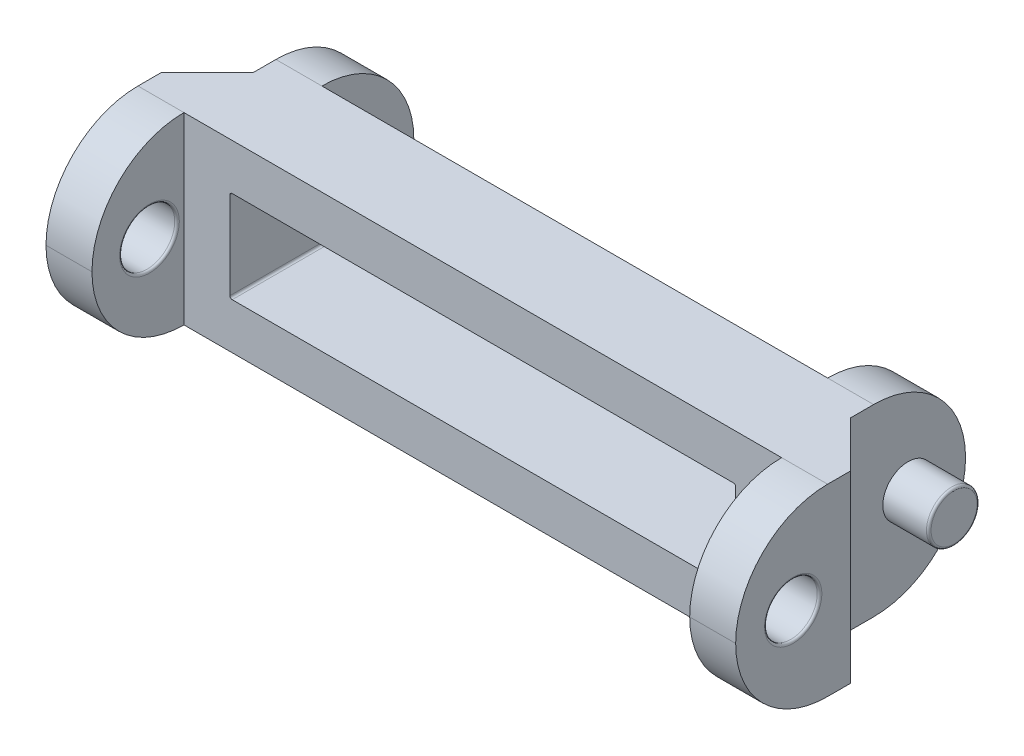
from build123d import *

# Parameters (mm, degrees)
SKETCH1_W           = 13
SKETCH1_H           = 4
SKETCH1_W_2         = 11
SKETCH1_H_2         = 2
EXTRUDE_THIN2_DEPTH = 1
SKETCH3_W           = 2.5
SKETCH3_H           = 4
BOSS_EXTRUDE1_DEPTH = 1
FILLET1_R           = 2
CHAMFER1_SIZE       = 1
SKETCH5_W           = 2
SKETCH5_H           = 4
BOSS_EXTRUDE2_DEPTH = 1
FILLET2_R           = 2
FILLET3_R           = 2
CHAMFER2_SIZE       = 1
SKETCH6_W           = 2
SKETCH6_H           = 4
BOSS_EXTRUDE4_DEPTH = 1
FILLET5_R           = 2
SKETCH7_R           = 0.573833464
CUT_EXTRUDE1_DEPTH  = 1
SKETCH8_R           = 0.55
BOSS_EXTRUDE5_DEPTH = 1
FILLET7_R           = 0.05
FILLET8_R           = 0.05
FILLET9_R           = 0.05
FILLET10_R          = 0.05
SKETCH9_R           = 0.6
CUT_EXTRUDE2_DEPTH  = 1
FILLET11_R          = 0.05
BOSS_EXTRUDE6_START = 1
SKETCH10_R          = 0.55
BOSS_EXTRUDE6_DEPTH = 1
FILLET12_R          = 0.05


with BuildPart() as part:
    # Sketch1 → Extrude-Thin2 (new, symmetric)
    with BuildSketch(Plane.XY):
        Rectangle(SKETCH1_W, SKETCH1_H)
        Rectangle(SKETCH1_W_2, SKETCH1_H_2, mode=Mode.SUBTRACT)
    extrude(amount=EXTRUDE_THIN2_DEPTH, both=True)

    # Sketch3 → Boss-Extrude1 (add)
    with BuildSketch(Plane(origin=(6.5, 0, 0), x_dir=(0, 0, -1), z_dir=(1, 0, 0))):
        with Locations((-1.75, 0)):
            Rectangle(SKETCH3_W, SKETCH3_H)
    boss_extrude1 = extrude(amount=BOSS_EXTRUDE1_DEPTH)

    # Fillet1
    fillet1_edges = [part.edges().sort_by_distance(p)[0] for p in [
        (7, -2, 3),
        (7, 2, 3),
    ]]
    fillet(fillet1_edges, radius=FILLET1_R - 0.0001)  # a hair under: the kernel refuses the full size

    # Chamfer1
    chamfer1_edges = [part.edges().sort_by_distance(p)[0] for p in [
        (6.5, 0, 0.5),
    ]]
    chamfer(chamfer1_edges, length=CHAMFER1_SIZE - 0.0001)  # a hair under: the kernel refuses the full size

    # Mirror2: Boss-Extrude1 across plane
    add(boss_extrude1.mirror(Plane(origin=(0, 0, 0), x_dir=(0, 0, 1), z_dir=(1, 0, 0))))

    # Sketch5 → Boss-Extrude2 (add)
    with BuildSketch(Plane(origin=(6.5, 0, 0), x_dir=(0, 0, -1), z_dir=(1, 0, 0))):
        with Locations((2, 0)):
            Rectangle(SKETCH5_W, SKETCH5_H)
    extrude(amount=-BOSS_EXTRUDE2_DEPTH)

    # Fillet2
    fillet2_edges = [part.edges().sort_by_distance(p)[0] for p in [
        (6, -2, -3),
        (6, 2, -3),
    ]]
    fillet(fillet2_edges, radius=FILLET2_R - 0.0001)  # a hair under: the kernel refuses the full size

    # Fillet3
    fillet3_edges = [part.edges().sort_by_distance(p)[0] for p in [
        (-7, 2, 3),
        (-7, -2, 3),
    ]]
    fillet(fillet3_edges, radius=FILLET3_R - 0.0001)  # a hair under: the kernel refuses the full size

    # Chamfer2
    chamfer2_edges = [part.edges().sort_by_distance(p)[0] for p in [
        (-6.5, 0, 0.5),
    ]]
    chamfer(chamfer2_edges, length=CHAMFER2_SIZE - 0.0001)  # a hair under: the kernel refuses the full size

    # Sketch6 → Boss-Extrude4 (add)
    with BuildSketch(Plane.ZY.offset(6.5)):
        with Locations((-2, 0)):
            Rectangle(SKETCH6_W, SKETCH6_H)
    extrude(amount=-BOSS_EXTRUDE4_DEPTH)

    # Fillet5
    fillet5_edges = [part.edges().sort_by_distance(p)[0] for p in [
        (-6, -2, -3),
        (-6, 2, -3),
    ]]
    fillet(fillet5_edges, radius=FILLET5_R - 0.0001)  # a hair under: the kernel refuses the full size

    # Sketch7 → Cut-Extrude1 (cut)
    with BuildSketch(Plane(origin=(7.5, 0, 0), x_dir=(0, 0, -1), z_dir=(1, 0, 0))):
        with Locations((-1.75, 0)):
            Circle(SKETCH7_R)
    extrude(amount=-CUT_EXTRUDE1_DEPTH, mode=Mode.SUBTRACT)

    # Sketch8 → Boss-Extrude5 (add)
    with BuildSketch(Plane(origin=(6.5, 0, 0), x_dir=(0, 0, -1), z_dir=(1, 0, 0))):
        with Locations(Location((1.75, 0, 0), (0, 0, 180))):
            Circle(SKETCH8_R)
    extrude(amount=BOSS_EXTRUDE5_DEPTH)

    # Fillet7
    fillet7_edges = [part.edges().sort_by_distance(p)[0] for p in [
        (7.5, 0, -2.3),
    ]]
    fillet(fillet7_edges, radius=FILLET7_R)

    # Fillet8
    fillet8_edges = [part.edges().sort_by_distance(p)[0] for p in [
        (5.5, -1, 0),
        (5.5, 1, 0),
    ]]
    fillet(fillet8_edges, radius=FILLET8_R)

    # Fillet9
    fillet9_edges = [part.edges().sort_by_distance(p)[0] for p in [
        (-5.5, 1, 0),
        (-5.5, -1, 0),
    ]]
    fillet(fillet9_edges, radius=FILLET9_R)

    # Fillet10
    fillet10_edges = [part.edges().sort_by_distance(p)[0] for p in [
        (6.5, 0, 2.323833464),
        (7.5, 0, 2.323833464),
    ]]
    fillet(fillet10_edges, radius=FILLET10_R)

    # Sketch9 → Cut-Extrude2 (cut)
    with BuildSketch(Plane.ZY.offset(7.5)):
        with Locations((1.75, 0)):
            Circle(SKETCH9_R)
    extrude(amount=-CUT_EXTRUDE2_DEPTH, mode=Mode.SUBTRACT)

    # Fillet11
    fillet11_edges = [part.edges().sort_by_distance(p)[0] for p in [
        (-6.5, 0, 1.15),
        (-7.5, 0, 1.15),
    ]]
    fillet(fillet11_edges, radius=FILLET11_R)

    # Sketch10 → Boss-Extrude6 (add)
    with BuildSketch(Plane.ZY.offset(6.5).offset(BOSS_EXTRUDE6_START)):
        with Locations((-1.75, 0)):
            Circle(SKETCH10_R)
    extrude(amount=-BOSS_EXTRUDE6_DEPTH)

    # Fillet12
    fillet12_edges = [part.edges().sort_by_distance(p)[0] for p in [
        (-7.5, 0, -2.3),
    ]]
    fillet(fillet12_edges, radius=FILLET12_R)


solid = part.part
